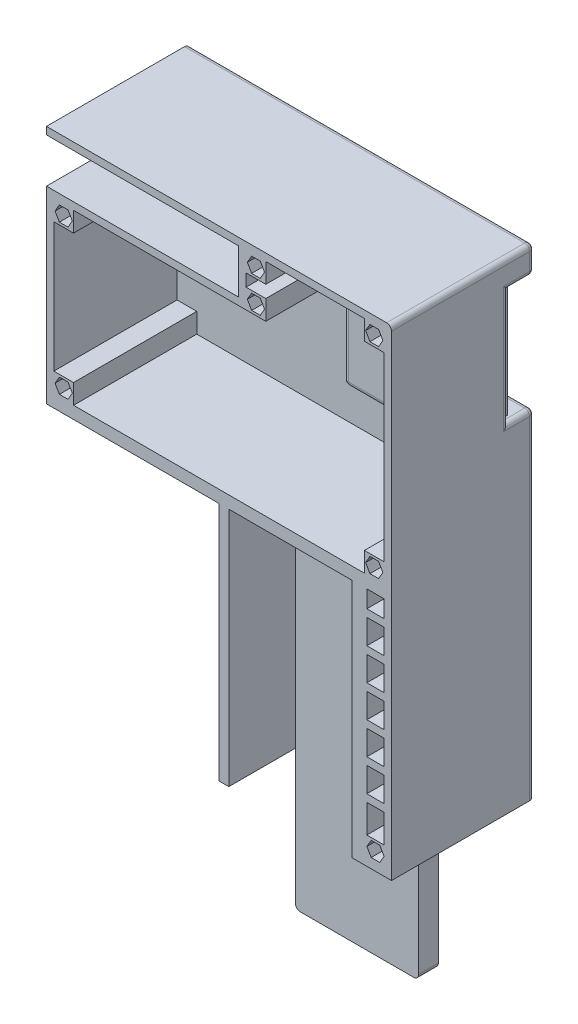
from build123d import *

# Parameters (mm, degrees)
EXTRUDE_1_DEPTH        = 8
SKETCH_7_W             = 53
SKETCH_7_H             = 154
EXTRUDE_4_DEPTH        = 8
SKETCH_8_W             = 3
SKETCH_8_H             = 56.5
CUT_EXTRUDE_7_DEPTH    = 184.508458055
SKETCH_11_W            = 75
SKETCH_11_H            = 3
EXTRUDE_7_DEPTH        = 50
SKETCH_13_W            = 3
SKETCH_13_H            = 94.5
EXTRUDE_8_DEPTH        = 40
SKETCH_14_W            = 3
SKETCH_14_H            = 97.5
EXTRUDE_13_DEPTH       = 17
EXTRUDE_14_DEPTH       = 50
SKETCH_18_W            = 6
SKETCH_18_H            = 94.5
EXTRUDE_15_DEPTH       = 35
SKETCH_3_W             = 57
SKETCH_3_H             = 23
CUT_EXTRUDE_10_DEPTH   = 56.5
SKETCH_19_W            = 8
SKETCH_19_H            = 8
EXTRUDE_19_DEPTH       = 43
SKETCH_25_W            = 10
SKETCH_25_H            = 3
EXTRUDE_20_DEPTH       = 15
SKETCH_26_W            = 8
SKETCH_26_H            = 8
SKETCH_26_W_2          = 7
EXTRUDE_21_DEPTH       = 7
SKETCH_28_W            = 47
SKETCH_28_H            = 47
CUT_EXTRUDE_11_DEPTH   = 10.5
SKETCH_29_W            = 44
SKETCH_29_H            = 47
EXTRUDE_22_DEPTH       = 16
SKETCH_30_R            = 1.5
CUT_EXTRUDE_13_DEPTH   = 15
EXTRUDE_START          = -18.5
EXTRUDE_23_DEPTH       = 18.5
FILLET_3_R             = 2
FILLET_4_R             = 2
FILLET_5_R             = 2
FILLET_7_R             = 2
FILLET_8_R             = 2
FILLET_9_R             = 2
SKETCH_32_W            = 7
SKETCH_32_H            = 3
EXTRUDE_24_DEPTH       = 50
PATTERN_LINEAR_1_COUNT = 6
PATTERN_LINEAR_1_PITCH = 13
FILLET_11_R            = 2
SKETCH_33_R            = 2.5
EXTRUDE_25_DEPTH       = 5
SKETCH_34_R            = 1.5
CUT_EXTRUDE_14_DEPTH   = 17
SKETCH_35_R            = 2.5
SKETCH_35_R_2          = 3.5
EXTRUDE_26_DEPTH       = 1.5


# Read off the part's stored shape, not the designer's step: 보스-돌출23
with BuildPart() as part:
    # 스케치1 → 보스-돌출1 (new body)
    with BuildSketch(Plane.XY):
        Polygon((114.748799453, 110.152671756), (44.748799453, 110.152671756), (-25.251200547, 110.152671756), (-25.251200547, 12.652671756), (44.748799453, 12.652671756), (44.748799453, -84.847328244), (114.748799453, -84.847328244), (114.748799453, 12.652671756), align=None)
    extrude(amount=EXTRUDE_1_DEPTH)

    # 스케치11 → 보스-돌출7 (add)
    with BuildSketch(Plane.XY.offset(8)):
        with Locations((15.248799453, 87.652671756)):
            Rectangle(SKETCH_11_W, SKETCH_11_H)
        Polygon((52.748799453, 107.152671756), (52.748799453, 89.152671756), (52.748799453, 86.152671756), (55.748799453, 86.152671756), (55.748799453, 107.152671756), align=None)
    extrude(amount=EXTRUDE_7_DEPTH)

    # 스케치13 → 보스-돌출8 (add)
    with BuildSketch(Plane.XY.offset(8)):
        with Locations((103.248799453, -34.597328244)):
            Rectangle(SKETCH_13_W, SKETCH_13_H)
    extrude(amount=EXTRUDE_8_DEPTH)

    # 스케치14 → 보스-돌출13 (add)
    with BuildSketch(Plane.XY.offset(31)):
        with Locations((100.248799453, -36.097328244)):
            Rectangle(SKETCH_14_W, SKETCH_14_H)
    extrude(amount=EXTRUDE_13_DEPTH)



with BuildPart() as body_2:
    # 스케치7 → 보스-돌출4 (new body)
    with BuildSketch(Plane(origin=(0, 0, 23), x_dir=(-1, 0, 0), z_dir=(0, 0, -1))):
        with Locations((-75.248799453, -64.347328244)):
            Rectangle(SKETCH_7_W, SKETCH_7_H)
    extrude(amount=-EXTRUDE_4_DEPTH)

    # 스케치8 → 컷-돌출7 (cut, through all)
    with BuildSketch(Plane(origin=(0, 0, 23), x_dir=(-1, 0, 0), z_dir=(0, 0, -1))):
        with Locations((-100.248799453, -113.097328244)):
            Rectangle(SKETCH_8_W, SKETCH_8_H)
    extrude(amount=-CUT_EXTRUDE_7_DEPTH, mode=Mode.SUBTRACT)


with BuildPart() as body_3:
    # 스케치15 → 보스-돌출14 (new body)
    with BuildSketch(Plane.XY.offset(8)):
        Polygon((-25.251200547, 17.652671756), (-25.251200547, 12.652671756), (44.748799453, 12.652671756), (44.748799453, -84.847328244), (48.748799453, -84.847328244), (48.748799453, 12.652671756), (101.748799453, 12.652671756), (104.748799453, 12.652671756), (111.748799453, 12.652671756), (111.748799453, -84.847328244), (114.748799453, -84.847328244), (114.748799453, 12.652671756), (114.748799453, 17.652671756), (114.748799453, 110.152671756), (111.748799453, 110.152671756), (-25.251200547, 110.152671756), (-25.251200547, 107.152671756), (52.748799453, 107.152671756), (52.825864214, 107.152671756), (55.748799453, 107.152671756), (111.748799453, 107.152671756), (111.748799453, 17.652671756), (-22.251200547, 17.652671756), (-22.251200547, 86.152671756), (-22.251200547, 89.152671756), (-25.251200547, 89.152671756), align=None)
    extrude(amount=EXTRUDE_14_DEPTH)


with BuildPart() as part_1:
    add(part.part)

    add(body_3.part)  # 보스-돌출15 merges body 3
    # 스케치18 → 보스-돌출15 (add)
    with BuildSketch(Plane(origin=(0, 0, 23), x_dir=(-1, 0, 0), z_dir=(0, 0, -1))):
        with Locations((-101.748799453, -34.597328244)):
            Rectangle(SKETCH_18_W, SKETCH_18_H)
        Polygon((-98.748799453, -84.847328244), (-98.748799453, -81.847328244), (-104.748799453, -81.847328244), (-111.748799453, -81.847328244), (-111.748799453, -84.847328244), align=None)
    extrude(amount=-EXTRUDE_15_DEPTH)

    # 스케치3 → 컷-돌출10 (cut)
    with BuildSketch(Plane.XZ.offset(84.847328244)):
        with Locations((73.248799453, 11.5)):
            Rectangle(SKETCH_3_W, SKETCH_3_H)
    extrude(amount=-CUT_EXTRUDE_10_DEPTH, mode=Mode.SUBTRACT)

    # 스케치19 → 보스-돌출19 (add)
    # profile 1 of 7: a face of its own
    with BuildSketch(Plane.XY.offset(15)):
        with Locations((59.748799453, 103.152671756)):
            Rectangle(SKETCH_19_W, SKETCH_19_H)
        Polygon((56.248799453, 103.153760669), (57.998799453, 100.122671756), (61.498799453, 100.122671756), (63.248799453, 103.153760669), (61.498799453, 106.184849582), (57.998799453, 106.184849582), align=None, mode=Mode.SUBTRACT)
    # profile 2 of 7: a face of its own
    with BuildSketch(Plane.XY.offset(15)):
        with Locations((107.748799453, 103.152671756)):
            Rectangle(SKETCH_19_W, SKETCH_19_H)
        Polygon((104.248799453, 103.153760669), (105.998799453, 100.122671756), (109.498799453, 100.122671756), (111.248799453, 103.153760669), (109.498799453, 106.184849582), (105.998799453, 106.184849582), align=None, mode=Mode.SUBTRACT)
    # profile 3 of 7: a face of its own
    with BuildSketch(Plane.XY.offset(15)):
        with Locations((-18.251200547, 21.652671756)):
            Rectangle(SKETCH_19_W, SKETCH_19_H)
        Polygon((-21.751200547, 21.653760669), (-20.001200547, 18.622671756), (-16.501200547, 18.622671756), (-14.751200547, 21.653760669), (-16.501200547, 24.684849582), (-20.001200547, 24.684849582), align=None, mode=Mode.SUBTRACT)
    # profile 4 of 7: a face of its own
    with BuildSketch(Plane.XY.offset(15)):
        with Locations((-18.251200547, 82.152671756)):
            Rectangle(SKETCH_19_W, SKETCH_19_H)
        Polygon((-21.751200547, 82.153760669), (-20.001200547, 79.122671756), (-16.501200547, 79.122671756), (-14.751200547, 82.153760669), (-16.501200547, 85.184849582), (-20.001200547, 85.184849582), align=None, mode=Mode.SUBTRACT)
    # profile 5 of 7: a face of its own
    with BuildSketch(Plane.XY.offset(15)):
        with Locations((108.248799453, -77.847328244)):
            Rectangle(SKETCH_19_W, SKETCH_19_H)
        Polygon((104.748799453, -77.846239331), (106.498799453, -80.877328244), (109.998799453, -80.877328244), (111.748799453, -77.846239331), (109.998799453, -74.815150418), (106.498799453, -74.815150418), align=None, mode=Mode.SUBTRACT)
    # profile 6 of 7: a face of its own
    with BuildSketch(Plane.XY.offset(15)):
        with Locations((107.748799453, 21.652671756)):
            Rectangle(SKETCH_19_W, SKETCH_19_H)
        Polygon((104.248799453, 21.653760669), (105.998799453, 18.622671756), (109.498799453, 18.622671756), (111.248799453, 21.653760669), (109.498799453, 24.684849582), (105.998799453, 24.684849582), align=None, mode=Mode.SUBTRACT)
    # profile 7 of 7: a face of its own
    with BuildSketch(Plane.XY.offset(15)):
        with Locations((59.748799453, 90.152671756)):
            Rectangle(SKETCH_19_W, SKETCH_19_H)
        Polygon((56.248799453, 90.153760669), (57.998799453, 87.122671756), (61.498799453, 87.122671756), (63.248799453, 90.153760669), (61.498799453, 93.184849582), (57.998799453, 93.184849582), align=None, mode=Mode.SUBTRACT)
    extrude(amount=EXTRUDE_19_DEPTH)


    add(body_2.part)  # 보스-돌출20 merges body 2
    # 스케치25 → 보스-돌출20 (add)
    with BuildSketch(Plane.XY.offset(8)):
        with Locations((106.748799453, -83.347328244)):
            Rectangle(SKETCH_25_W, SKETCH_25_H)
    extrude(amount=EXTRUDE_20_DEPTH)

    # 스케치26 → 보스-돌출21 (add)
    with BuildSketch(Plane.XY.offset(8)):
        with Locations((59.748799453, 103.152671756)):
            Rectangle(SKETCH_26_W, SKETCH_26_H)
        with Locations((59.748799453, 90.152671756)):
            Rectangle(SKETCH_26_W, SKETCH_26_H)
        with Locations((107.748799453, 103.152671756)):
            Rectangle(SKETCH_26_W, SKETCH_26_H)
        with Locations((107.748799453, 21.652671756)):
            Rectangle(SKETCH_26_W, SKETCH_26_H)
        with Locations((-18.251200547, 21.652671756)):
            Rectangle(SKETCH_26_W, SKETCH_26_H)
        with Locations((-18.251200547, 82.152671756)):
            Rectangle(SKETCH_26_W, SKETCH_26_H)
        with Locations((108.248799453, -77.847328244)):
            Rectangle(SKETCH_26_W_2, SKETCH_26_H)
    extrude(amount=EXTRUDE_21_DEPTH)

    # 스케치28 → 컷-돌출11 (cut)
    with BuildSketch(Plane(origin=(0, 0, 0), x_dir=(-1, 0, 0), z_dir=(0, 0, -1))):
        with Locations((-91.248799453, 75.652671756)):
            Rectangle(SKETCH_28_W, SKETCH_28_H)
    extrude(amount=-CUT_EXTRUDE_11_DEPTH, mode=Mode.SUBTRACT)

    # 스케치29 → 보스-돌출22 (add)
    with BuildSketch(Plane(origin=(0, 0, 10.5), x_dir=(-1, 0, 0), z_dir=(0, 0, -1))):
        with Locations((-89.748799453, 75.652671756)):
            Rectangle(SKETCH_29_W, SKETCH_29_H)
    extrude(amount=-EXTRUDE_22_DEPTH)

    # 스케치30 → 컷-돌출13 (cut)
    with BuildSketch(Plane(origin=(0, 0, 10.5), x_dir=(-1, 0, 0), z_dir=(0, 0, -1))):
        with Locations((-101.998799453, 90.402671756)):
            Circle(SKETCH_30_R)
        with Locations((-80.498799453, 90.402671756)):
            Circle(SKETCH_30_R)
        with Locations((-101.998799453, 60.902671756)):
            Circle(SKETCH_30_R)
        with Locations((-80.498799453, 60.902671756)):
            Circle(SKETCH_30_R)
    extrude(amount=-CUT_EXTRUDE_13_DEPTH, mode=Mode.SUBTRACT)

    # 보스-돌출23 outline → 보스-돌출23 (add)
    with BuildSketch(Plane.XY.offset(26.5).offset(EXTRUDE_START)):
        Polygon((63.748799453, 48.152671756), (111.748799453, 48.152671756), (111.748799453, 99.152671756), (103.748799453, 99.152671756), (103.748799453, 107.152671756), (63.748799453, 107.152671756), (63.748799453, 99.152671756), (55.748799453, 99.152671756), (55.748799453, 94.152671756), (63.748799453, 94.152671756), align=None)
    extrude(amount=EXTRUDE_23_DEPTH)

    # 필렛3
    fillet_3_edges = [part_1.edges().sort_by_distance(p)[0] for p in [
        (114.748799453, 110.152671756, 29),
    ]]
    fillet(fillet_3_edges, radius=FILLET_3_R)

    # 필렛4
    fillet_4_edges = [part_1.edges().sort_by_distance(p)[0] for p in [
        (114.748799453, -16.347328244, 0),
    ]]
    fillet(fillet_4_edges, radius=FILLET_4_R)

    # 필렛5
    fillet_5_edges = [part_1.edges().sort_by_distance(p)[0] for p in [
        (43.748799453, 110.152671756, 0),
        (114.748799453, 103.652671756, 0),
        (114.163013015, 109.566885318, 0),
    ]]
    fillet(fillet_5_edges, radius=FILLET_5_R)

    # 필렛7
    fillet_7_edges = [part_1.edges().sort_by_distance(p)[0] for p in [
        (114.748799453, 75.652671756, 10.5),
        (67.748799453, 75.652671756, 0),
    ]]
    fillet(fillet_7_edges, radius=FILLET_7_R)

    # 필렛8
    fillet_8_edges = [part_1.edges().sort_by_distance(p)[0] for p in [
        (114.748799453, 99.152671756, 7.25),
        (114.163013015, 99.152671756, 0.585786438),
        (114.748799453, 52.152671756, 7.25),
        (114.163013015, 52.152671756, 0.585786438),
        (89.248799453, 99.152671756, 0),
        (89.248799453, 52.152671756, 0),
    ]]
    fillet(fillet_8_edges, radius=FILLET_8_R - 0.0001)  # a hair under: the kernel refuses the full size

    # 필렛9
    fillet_9_edges = [part_1.edges().sort_by_distance(p)[0] for p in [
        (98.748799453, -141.347328244, 27),
        (48.748799453, -141.347328244, 27),
    ]]
    fillet(fillet_9_edges, radius=FILLET_9_R)

    # 스케치32 → 보스-돌출24 (add)
    with BuildSketch(Plane.XY.offset(8)):
        with Locations((108.248799453, 4.152671756)):
            Rectangle(SKETCH_32_W, SKETCH_32_H)
    extrude_24 = extrude(amount=EXTRUDE_24_DEPTH)

    # 선형 패턴1: 보스-돌출24 ×6
    with Locations(*[(0, -i * PATTERN_LINEAR_1_PITCH, 0) for i in range(1, PATTERN_LINEAR_1_COUNT)]):
        add(extrude_24)

    # 필렛11
    fillet_11_edges = [part_1.edges().sort_by_distance(p)[0] for p in [
        (63.748799453, 48.152671756, 17.25),
        (87.748799453, 48.152671756, 26.5),
        (63.748799453, 67.152671756, 26.5),
    ]]
    fillet(fillet_11_edges, radius=FILLET_11_R)

    # 스케치33 → 보스-돌출25 (add)
    with BuildSketch(Plane(origin=(0, 0, 23), x_dir=(-1, 0, 0), z_dir=(0, 0, -1))):
        with Locations(Location((-73.748799453, -33.647328244, 0), (0, 0, 180))):
            Circle(SKETCH_33_R)
        with Locations(Location((-73.748799453, -120.647328244, 0), (0, 0, 180))):
            Circle(SKETCH_33_R)
        with BuildLine():
            Line((-71.748799453, -7.147328244), (-71.748799453, -13.147328244))
            ThreePointArc((-71.748799453, -13.147328244), (-73.748799453, -15.147328244), (-75.748799453, -13.147328244))
            Line((-75.748799453, -13.147328244), (-75.748799453, -7.147328244))
            ThreePointArc((-75.748799453, -7.147328244), (-73.748799453, -5.147328244), (-71.748799453, -7.147328244))
        make_face()
        with BuildLine():
            Line((-70.748799453, -26.147328244), (-76.748799453, -26.147328244))
            ThreePointArc((-76.748799453, -26.147328244), (-78.748799453, -24.147328244), (-76.748799453, -22.147328244))
            Line((-76.748799453, -22.147328244), (-70.748799453, -22.147328244))
            ThreePointArc((-70.748799453, -22.147328244), (-68.748799453, -24.147328244), (-70.748799453, -26.147328244))
        make_face()
    extrude(amount=EXTRUDE_25_DEPTH)

    # 스케치34 → 컷-돌출14 (cut)
    with BuildSketch(Plane(origin=(0, 0, 8), x_dir=(-1, 0, 0), z_dir=(0, 0, -1))):
        with Locations((-100.998799453, 90.902671756)):
            Circle(SKETCH_34_R)
        with Locations((-79.498799453, 90.902671756)):
            Circle(SKETCH_34_R)
        with Locations((-79.498799453, 60.402671756)):
            Circle(SKETCH_34_R)
        with Locations((-100.998799453, 60.402671756)):
            Circle(SKETCH_34_R)
    extrude(amount=-CUT_EXTRUDE_14_DEPTH, mode=Mode.SUBTRACT)

    # 스케치35 → 보스-돌출26 (add)
    with BuildSketch(Plane.XZ.offset(-107.152671756)):
        with Locations(Location((31.248799453, 32.763001925, 0), (0, 0, 90))):
            Circle(SKETCH_35_R)
        with Locations(Location((-3.251200547, 32.763001925, 0), (0, 0, 90))):
            Circle(SKETCH_35_R_2)
        with BuildLine():
            Line((16.248799453, 30.263001925), (10.248799453, 30.263001925))
            ThreePointArc((10.248799453, 30.263001925), (7.748799453, 32.763001925), (10.248799453, 35.263001925))
            Line((10.248799453, 35.263001925), (16.248799453, 35.263001925))
            ThreePointArc((16.248799453, 35.263001925), (18.748799453, 32.763001925), (16.248799453, 30.263001925))
        make_face()
    extrude(amount=EXTRUDE_26_DEPTH)


solid = part_1.part
